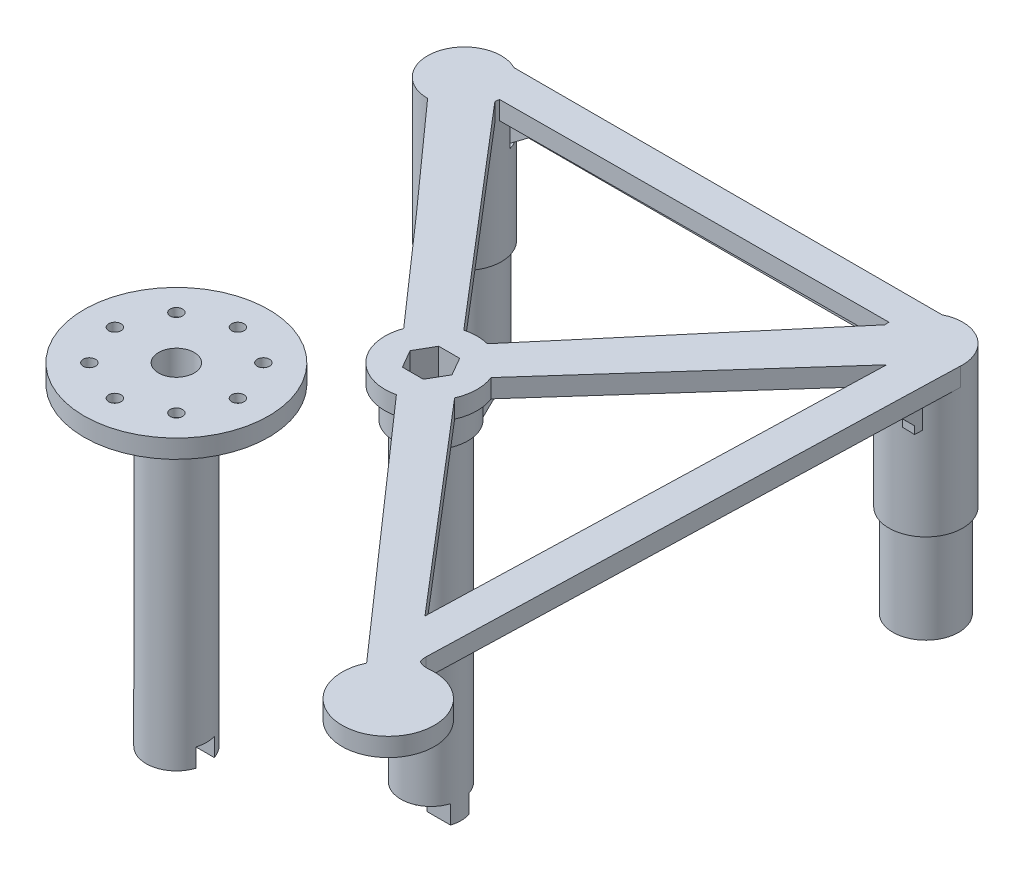
from build123d import *
from build123d.topology import SkipClean

# Parameters (mm, degrees)
EXTRUDE_1_DEPTH          = 3
SKETCH_2_R               = 5.35
EXTRUDE_2_DEPTH          = 23
CUT_EXTRUDE_1_DEPTH      = 3
SKETCH_4_R               = 5
EXTRUDE_3_DEPTH          = 100
EXTRUDE_START            = 3
SKETCH_5_R               = 5
EXTRUDE_4_DEPTH          = 3
SKETCH_6_R               = 5.35
EXTRUDE_5_DEPTH          = 5
SKETCH_7_R               = 5.35
EXTRUDE_6_DEPTH          = 5
SKETCH_8_W               = 75
SKETCH_8_H               = 10.7
EXTRUDE_7_DEPTH          = 3
EXTRUDE_8_DEPTH          = 3
CUT_EXTRUDE_2_DEPTH      = 3
SKETCH_12_R              = 6
EXTRUDE_10_DEPTH         = 13
SKETCH_13_R              = 3
CUT_EXTRUDE_3_DEPTH      = 23
SKETCH_14_R              = 3.125
CUT_EXTRUDE_5_DEPTH      = 100
SKETCH_15_R              = 6
SKETCH_15_R_2            = 5.35
EXTRUDE_11_DEPTH         = 5
SKETCH_16_R              = 6
SKETCH_16_R_2            = 3
EXTRUDE_12_DEPTH         = 5
SKETCH_17_R              = 5.35
SKETCH_17_R_2            = 3
EXTRUDE_13_DEPTH         = 5
SKETCH_18_R              = 5.35
SKETCH_18_R_2            = 3
EXTRUDE_14_DEPTH         = 5
SKETCH_20_R              = 6
SKETCH_20_R_2            = 5.35
EXTRUDE_15_DEPTH         = 5
SKETCH_21_R              = 6
SKETCH_21_R_2            = 5.35
EXTRUDE_16_DEPTH         = 5
SKETCH_22_R              = 5.35
SKETCH_22_R_2            = 3
EXTRUDE_17_DEPTH         = 5
SKETCH_23_R              = 5.35
SKETCH_23_R_2            = 3
EXTRUDE_18_DEPTH         = 5
SKETCH_25_R              = 7.5
EXTRUDE_20_DEPTH         = 3
EXTRUDE_21_DEPTH         = 3
EXTRUDE_23_DEPTH         = 3
SKETCH_30_R              = 7.5
EXTRUDE_24_DEPTH         = 3
FILLET_1_R               = 3
EXTRUDE_29_DEPTH         = 5
EXTRUDE_31_DEPTH         = 2
SKETCH_50_R              = 5.998205811
EXTRUDE_32_DEPTH         = 103
CUT_EXTRUDE_START        = -95
SKETCH_52_R              = 5.998205811
SKETCH_52_R_2            = 4.9
CUT_EXTRUDE_7_DEPTH      = 95
CUT_EXTRUDE_START_2      = -44
SKETCH_53_R              = 4.9
CUT_EXTRUDE_8_DEPTH      = 44
SKETCH_54_R              = 1.5
EXTRUDE_33_DEPTH         = 5
CUT_EXTRUDE_9_DEPTH      = 56
CUT_EXTRUDE_START_3      = -6
SKETCH_56_R              = 1.5
CUT_EXTRUDE_10_DEPTH     = 6
SKETCH_57_R              = 15
EXTRUDE_34_DEPTH         = 3
SKETCH_58_R              = 4.9
EXTRUDE_35_DEPTH         = 51
CUT_EXTRUDE_11_DEPTH     = 5
SKETCH_60_R              = 2.75
CUT_EXTRUDE_12_DEPTH     = 46
SKETCH_61_R              = 1.5
CUT_EXTRUDE_13_DEPTH     = 9
CUT_EXTRUDE_14_DEPTH     = 1.65
SKETCH_63_R              = 1
CUT_EXTRUDE_15_DEPTH     = 1.5
PATTERN_CIRCULAR_1_COUNT = 8
SKETCH_64_R              = 3.175426481
CUT_EXTRUDE_17_DEPTH     = 5
CUT_EXTRUDE_18_DEPTH     = 56
FILLET_2_R               = 1
EXTRUDE_36_DEPTH         = 5
SKETCH_67_R              = 1.5
CUT_EXTRUDE_19_DEPTH     = 5
FILLET_3_R               = 1
SKETCH_69_R              = 4.9
EXTRUDE_37_DEPTH         = 3
CUT_EXTRUDE_20_DEPTH     = 3
CUT_EXTRUDE_21_DEPTH     = 3
SKETCH_71_R              = 2.9
CUT_EXTRUDE_22_DEPTH     = 46
FILLET_4_R               = 1
SKETCH_72_R              = 1.742227019
CUT_EXTRUDE_23_DEPTH     = 3


with BuildPart() as part:
    # 草图1 → 凸台-拉伸1 (new body)
    with BuildSketch(Plane(origin=(0, 0, 0), x_dir=(1, 0, 0), z_dir=(0, 1, 0))):
        Polygon((-18.65535641, 0), (18.84464359, -42.930983399), (56.34464359, 0), align=None)
    extrude(amount=EXTRUDE_1_DEPTH)

    # 草图2 → 凸台-拉伸2 (add)
    with BuildSketch(Plane(origin=(0, 3, 0), x_dir=(1, 0, 0), z_dir=(0, 1, 0))):
        with Locations(Location((56.34464359, 0, 0), (0, 0, 270))):
            Circle(SKETCH_2_R)
        with Locations(Location((-18.65535641, 0, 0), (0, 0, 270))):
            Circle(SKETCH_2_R)
    extrude(amount=-EXTRUDE_2_DEPTH)

    # 草图3 → 切除-拉伸1 (cut)
    with BuildSketch(Plane.XZ):
        Polygon((8.632668758, 17.559374543), (1.15609776, 9), (33.75905687, 9), (36.53318942, 9), (29.056618422, 17.559374543), (18.84464359, 29.25031113), align=None)
    extrude(amount=-CUT_EXTRUDE_1_DEPTH, mode=Mode.SUBTRACT)

    # 草图4 → 凸台-拉伸3 (add)
    with BuildSketch(Plane.XZ):
        with Locations(Location((18.84464359, 42.930983399, 0), (0, 0, 228.862949093))):
            Circle(SKETCH_4_R)
    extrude(amount=EXTRUDE_3_DEPTH)

    # 草图5 → 凸台-拉伸4 (add)
    with BuildSketch(Plane(origin=(0, 0, 0), x_dir=(1, 0, 0), z_dir=(0, 1, 0)).offset(EXTRUDE_START)):
        with Locations(Location((18.84464359, -42.930983399, 0), (0, 0, 131.137050907))):
            Circle(SKETCH_5_R)
    extrude(amount=-EXTRUDE_4_DEPTH)

    # 草图6 → 凸台-拉伸5 (add)
    with SkipClean():  # the faces are left unmerged after this step: merging them gives an invalid solid
        with BuildSketch(Plane.XZ.offset(20)):
            with Locations(Location((56.34464359, 0, 0), (0, 0, 131.137050907))):
                Circle(SKETCH_6_R)
        extrude(amount=EXTRUDE_5_DEPTH)
    add(part.part.scale(1), mode=Mode.REPLACE)  # the faces are merged on a copy

    # 草图7 → 凸台-拉伸6 (add)
    with BuildSketch(Plane.XZ.offset(20)):
        with Locations(Location((-18.65535641, 0, 0), (0, 0, 48.862949093))):
            Circle(SKETCH_7_R)
    extrude(amount=EXTRUDE_6_DEPTH)

    # 草图8 → 凸台-拉伸7 (add)
    with SkipClean():  # the faces are left unmerged after this step: merging them gives an invalid solid
        with BuildSketch(Plane(origin=(0, 3, 0), x_dir=(1, 0, 0), z_dir=(0, 1, 0))):
            with Locations((18.84464359, 0)):
                Rectangle(SKETCH_8_W, SKETCH_8_H)
        extrude(amount=-EXTRUDE_7_DEPTH)

    # 草图9 → 凸台-拉伸8 (add)
    with SkipClean():  # the faces are left unmerged after this step: merging them gives an invalid solid
        with BuildSketch(Plane(origin=(0, 3, 0), x_dir=(1, 0, 0), z_dir=(0, 1, 0))):
            Polygon((61.69464359, 0), (18.84464359, -47.930983399), (-24.00535641, 0), align=None)
        extrude(amount=-EXTRUDE_8_DEPTH)

    # 草图10 → 切除-拉伸2 (cut)
    with SkipClean():  # the faces are left unmerged after this step: merging them gives an invalid solid
        with BuildSketch(Plane.XZ):
            Polygon((18.84464359, 37.930983399), (-13.313716495, 0.298969924), (50.99464359, 0), align=None)
        extrude(amount=-CUT_EXTRUDE_2_DEPTH, mode=Mode.SUBTRACT)

    # 草图12 → 凸台-拉伸10 (add)
    with SkipClean():  # the faces are left unmerged after this step: merging them gives an invalid solid
        with BuildSketch(Plane(origin=(0, 3, 0), x_dir=(1, 0, 0), z_dir=(0, 1, 0))):
            with Locations(Location((-18.65535641, 0, 0), (0, 0, 270))):
                Circle(SKETCH_12_R)
            with Locations(Location((56.34464359, 0, 0), (0, 0, 270))):
                Circle(SKETCH_12_R)
        extrude(amount=-EXTRUDE_10_DEPTH)

    # 草图13 → 切除-拉伸3 (cut)
    with SkipClean():  # the faces are left unmerged after this step: merging them gives an invalid solid
        with BuildSketch(Plane.XZ.offset(25)):
            with Locations(Location((-18.65535641, 0, 0), (0, 0, 270))):
                Circle(SKETCH_13_R)
            with Locations(Location((56.34464359, 0, 0), (0, 0, 270))):
                Circle(SKETCH_13_R)
        extrude(amount=-CUT_EXTRUDE_3_DEPTH, mode=Mode.SUBTRACT)

    # 草图14 → 切除-拉伸5 (cut)
    with SkipClean():  # the faces are left unmerged after this step: merging them gives an invalid solid
        with BuildSketch(Plane.XZ.offset(100)):
            with Locations(Location((18.84464359, 42.930983399, 0), (0, 0, 270))):
                Circle(SKETCH_14_R)
        extrude(amount=-CUT_EXTRUDE_5_DEPTH, mode=Mode.SUBTRACT)

    # 草图15 → 凸台-拉伸11 (add)
    with SkipClean():  # the faces are left unmerged after this step: merging them gives an invalid solid
        with BuildSketch(Plane.XZ.offset(10)):
            with Locations(Location((56.34464359, 0, 0), (0, 0, 90.133194259))):
                Circle(SKETCH_15_R)
            with Locations(Location((56.34464359, 0, 0), (0, 0, 270))):
                Circle(SKETCH_15_R_2, mode=Mode.SUBTRACT)
        extrude(amount=EXTRUDE_11_DEPTH)

    # 草图16 → 凸台-拉伸12 (add)
    with SkipClean():  # the faces are left unmerged after this step: merging them gives an invalid solid
        with BuildSketch(Plane.XZ.offset(10)):
            with Locations(Location((-18.65535641, 0, 0), (0, 0, 89.866805741))):
                Circle(SKETCH_16_R)
            with Locations(Location((-18.65535641, 0, 0), (0, 0, 270))):
                Circle(SKETCH_16_R_2, mode=Mode.SUBTRACT)
        extrude(amount=EXTRUDE_12_DEPTH)

    # 草图17 → 凸台-拉伸13 (add)
    with SkipClean():  # the faces are left unmerged after this step: merging them gives an invalid solid
        with BuildSketch(Plane.XZ.offset(25)):
            with Locations(Location((-18.65535641, 0, 0), (0, 0, 270))):
                Circle(SKETCH_17_R)
            with Locations(Location((-18.65535641, 0, 0), (0, 0, 270))):
                Circle(SKETCH_17_R_2, mode=Mode.SUBTRACT)
        extrude(amount=EXTRUDE_13_DEPTH)

    # 草图18 → 凸台-拉伸14 (add)
    with SkipClean():  # the faces are left unmerged after this step: merging them gives an invalid solid
        with BuildSketch(Plane.XZ.offset(25)):
            with Locations(Location((56.34464359, 0, 0), (0, 0, 270))):
                Circle(SKETCH_18_R)
            with Locations(Location((56.34464359, 0, 0), (0, 0, 270))):
                Circle(SKETCH_18_R_2, mode=Mode.SUBTRACT)
        extrude(amount=EXTRUDE_14_DEPTH)

    # 草图20 → 凸台-拉伸15 (add)
    with SkipClean():  # the faces are left unmerged after this step: merging them gives an invalid solid
        with BuildSketch(Plane.XZ.offset(15)):
            with Locations(Location((-18.65535641, 0, 0), (0, 0, 89.866805741))):
                Circle(SKETCH_20_R)
            with Locations(Location((-18.65535641, 0, 0), (0, 0, 270))):
                Circle(SKETCH_20_R_2, mode=Mode.SUBTRACT)
        extrude(amount=EXTRUDE_15_DEPTH)

    # 草图21 → 凸台-拉伸16 (add)
    with SkipClean():  # the faces are left unmerged after this step: merging them gives an invalid solid
        with BuildSketch(Plane.XZ.offset(15)):
            with Locations(Location((56.34464359, 0, 0), (0, 0, 90.133194259))):
                Circle(SKETCH_21_R)
            with Locations(Location((56.34464359, 0, 0), (0, 0, 270))):
                Circle(SKETCH_21_R_2, mode=Mode.SUBTRACT)
        extrude(amount=EXTRUDE_16_DEPTH)

    # 草图22 → 凸台-拉伸17 (add)
    with SkipClean():  # the faces are left unmerged after this step: merging them gives an invalid solid
        with BuildSketch(Plane.XZ.offset(30)):
            with Locations(Location((-18.65535641, 0, 0), (0, 0, 270))):
                Circle(SKETCH_22_R)
            with Locations(Location((-18.65535641, 0, 0), (0, 0, 270))):
                Circle(SKETCH_22_R_2, mode=Mode.SUBTRACT)
        extrude(amount=EXTRUDE_17_DEPTH)

    # 草图23 → 凸台-拉伸18 (add)
    with SkipClean():  # the faces are left unmerged after this step: merging them gives an invalid solid
        with BuildSketch(Plane.XZ.offset(30)):
            with Locations(Location((56.34464359, 0, 0), (0, 0, 270))):
                Circle(SKETCH_23_R)
            with Locations(Location((56.34464359, 0, 0), (0, 0, 270))):
                Circle(SKETCH_23_R_2, mode=Mode.SUBTRACT)
        extrude(amount=EXTRUDE_18_DEPTH)

    # 草图25 → 凸台-拉伸20 (add)
    with SkipClean():  # the faces are left unmerged after this step: merging them gives an invalid solid
        with BuildSketch(Plane(origin=(0, 3, 0), x_dir=(1, 0, 0), z_dir=(0, 1, 0))):
            with Locations((18.84464359, -42.930983399)):
                Circle(SKETCH_25_R)
        extrude(amount=-EXTRUDE_20_DEPTH)

    # 草图28 → 凸台-拉伸21 (add)
    with SkipClean():  # the faces are left unmerged after this step: merging them gives an invalid solid
        with BuildSketch(Plane(origin=(0, 3, 0), x_dir=(1, 0, 0), z_dir=(0, 1, 0))):
            Polygon((-3.379636645, -23.071435978), (2.093554995, -18.328702995), (68.652557408, -96.216669577), (66.868599364, -97.910067347), (64.321605904, -100.026810209), align=None)
        extrude(amount=-EXTRUDE_21_DEPTH)

    # 草图29 → 凸台-拉伸23 (add)
    with SkipClean():  # the faces are left unmerged after this step: merging them gives an invalid solid
        with BuildSketch(Plane(origin=(0, 3, 0), x_dir=(1, 0, 0), z_dir=(0, 1, 0))):
            Polygon((56.34464359, 0), (53.74105837, -88), (59.74105837, -88), (62.34464359, 0), align=None)
        extrude(amount=-EXTRUDE_23_DEPTH)

    # 草图30 → 凸台-拉伸24 (add)
    with SkipClean():  # the faces are left unmerged after this step: merging them gives an invalid solid
        with BuildSketch(Plane(origin=(0, 3, 0), x_dir=(1, 0, 0), z_dir=(0, 1, 0))):
            with Locations((62.6531538, -93.694621783)):
                Circle(SKETCH_30_R)
        extrude(amount=-EXTRUDE_24_DEPTH)

    # 圆角1
    # the kernel refuses this fillet: 3 mm, written as the material it adds along each edge
    with BuildSketch(Plane(origin=(60.387632696, 0, 86.544977448), x_dir=(-0.6496534253779116, 0, -0.760230509052844), z_dir=(0, 1, 0))) as fillet_1_piece_1:
        with BuildLine():
            CenterArc((1.763131122, -3), FILLET_1_R, 90, 55.663998218)
            ThreePointArc((-0.714100998, -1.307864951), (-0.324488751, -0.671711358), (0, 0))
            Line((0, 0), (1.763131122, 0))
        make_face()
    extrude(amount=3)
    with BuildSketch(Plane(origin=(59.804303017, 0, 85.862359607), x_dir=(0.02957325513951661, 0, -0.9995626156376863), z_dir=(0, 1, 0))) as fillet_1_piece_2:
        with BuildLine():
            CenterArc((FILLET_1_R * 0.38596961824, -FILLET_1_R), FILLET_1_R, 90, 42.210146514)
            Line((-FILLET_1_R * 0.285882149698, -FILLET_1_R * 0.259314370385), (0, 0))
            Line((0, 0), (FILLET_1_R * 0.38596961824, 0))
        make_face()
    extrude(amount=3)

    # 草图31 → 凸台-拉伸29 (add)
    with BuildSketch(Plane.XZ):
        Polygon((-14.723586471, -1.628179316), (-14.723586471, -3.628179316), (53.527409972, -3.628179316), (53.82491501, -1.628179316), align=None)
        Polygon((49.609847968, 80.102545011), (51.130308987, 78.80323816), (22.318773999, 45.087710689), (20.798312981, 46.38701754), align=None)
        Polygon((-15.349607435, 4.086383285), (-13.829146417, 2.787076434), (17.097273349, 38.977461836), (15.576812331, 40.276768687), align=None)
        Polygon((20.325894576, 39.186783249), (51.86894969, 1.971881231), (53.394639731, 3.265043982), (21.851584617, 40.479945999), align=None)
        Polygon((56.093860655, 78.864293565), (58.318881117, 3.659610745), (60.319756269, 3.659610745), (58.092985887, 78.923440075), align=None)
    extrude(amount=EXTRUDE_29_DEPTH)

    # 切除-扫描1: sweep along a path in 草图36
    with BuildLine(Plane.XZ.offset(5)) as sweep_1_path:
        Line((18.84464359, -3.628179316), (18.84464359, -1.628179316))
    # 草图35 → 切除-扫描1 (sweep, cut)
    with BuildSketch(Plane(origin=(0, 0, -3.628179316), x_dir=(-1, 0, 0), z_dir=(0, 0, -1))):
        Polygon((13.876620714, -5), (9.876620714, -2), (-47.565907894, -2), (-51.565907894, -5), align=None)
    sweep(path=sweep_1_path.line, mode=Mode.SUBTRACT)

    # 切除-扫描3: sweep along a path in 草图38
    with BuildLine(Plane.XZ.offset(5)) as sweep_3_path:
        Line((59.19369399, 41.720005215), (57.192818839, 41.720005215))
    # 草图37 → 切除-扫描3 (sweep, cut)
    with BuildSketch(Plane(origin=(60.375181238, 0, 1.786271926), x_dir=(0.029573255139513054, 0, -0.9995626156376864), z_dir=(0.9995626156376866, 0, 0.029573255139513057))):
        Polygon((-2.73149314, -5), (-6.73149314, -1), (-73.170921503, -1), (-77.170921503, -5), align=None)
    sweep(path=sweep_3_path.line, mode=Mode.SUBTRACT)

    # 草图39 → 凸台-拉伸31 (add)
    with BuildSketch(Plane(origin=(58.376056006, 0, 1.727125416), x_dir=(0.02957325513951297, 0, -0.9995626156376864), z_dir=(0.9995626156376866, 0, 0.029573255139512974))):
        Polygon((-3.961044, -3.829621531), (-3.961044, -5), (-2.73149314, -5), (-2.73149314, -4.501704435), (-3.961044, -3.272153575), align=None)
    extrude(amount=EXTRUDE_31_DEPTH)

    # 切除-扫描5: sweep along a path in 草图42
    with BuildLine(Plane.XZ.offset(5)) as sweep_5_path:
        Line((0.095091388, 22.159914171), (1.552120507, 20.786378718))
    # 草图40 → 切除-扫描5 (sweep, cut)
    with BuildSketch(Plane(origin=(-10.889521113, 0, 9.305617977), x_dir=(0.6496534253779145, 0, 0.7602305090528415), z_dir=(-0.7602305090528415, 0, 0.6496534253779145))):
        Polygon((-5.121187346, -5), (-3.121187346, -1), (36.9380259, -1), (38.9380259, -5), align=None)
    sweep(path=sweep_5_path.line, mode=Mode.SUBTRACT)

    # 切除-扫描6: sweep along a path in 草图44
    with BuildLine(Plane.XZ.offset(5)) as sweep_6_path:
        Line((36.035656698, 20.652203895), (37.472857905, 22.049766909))
    # 草图43 → 切除-扫描6 (sweep, cut)
    with BuildSketch(Plane(origin=(31.1568423, 0, 26.408291855), x_dir=(-0.6465813751887421, 0, 0.7628450204720715), z_dir=(-0.7628450204720715, 0, -0.6465813751887421))):
        Polygon((14.734624595, -5), (12.734624595, -1), (-27.825731715, -1), (-29.825731715, -5), align=None)
    sweep(path=sweep_6_path.line, mode=Mode.SUBTRACT)

    # 切除-扫描7: sweep along a path in 草图47
    with BuildLine(Plane.XZ.offset(5)) as sweep_7_path:
        Line((37.03221924, 62.305521799), (35.511758222, 63.60482865))
    # 草图46 → 切除-扫描7 (sweep, cut)
    with BuildSketch(Plane(origin=(-10.889521113, 0, 9.305617977), x_dir=(0.6496534253779142, 0, 0.7602305090528417), z_dir=(-0.7602305090528417, 0, 0.6496534253779142))):
        Polygon((50.821835343, -5), (52.821835343, -1), (88.125606235, -1), (93.125606235, 0), (93.125606235, -5), align=None)
    sweep(path=sweep_7_path.line, mode=Mode.SUBTRACT)

    # 切除-扫描8: sweep along a path in 草图49
    with BuildLine(Plane.XZ.offset(1)) as sweep_8_path:
        Line((58.211278907, 74.925189613), (56.210403756, 74.925189613))
        Line((56.210403756, 74.925189613), (55.379994456, 74.925189613))
    # 草图48 → 切除-扫描8 (sweep, cut)
    with BuildSketch(Plane(origin=(60.375181238, 0, 1.786271926), x_dir=(0.029573255139513054, 0, -0.9995626156376864), z_dir=(0.9995626156376866, 0, 0.029573255139513057))):
        Polygon((-73.170921503, -1), (-77.170921503, 0), (-77.170921503, -5), align=None)
    sweep(path=sweep_8_path.line, mode=Mode.SUBTRACT)

    # 草图50 → 凸台-拉伸32 (add)
    with BuildSketch(Plane(origin=(0, 3, 0), x_dir=(1, 0, 0), z_dir=(0, 1, 0))):
        with Locations(Location((18.84464359, -42.930983399, 0), (0, 0, 270))):
            Circle(SKETCH_50_R)
    extrude(amount=-EXTRUDE_32_DEPTH)

    # 草图52 → 切除-拉伸7 (cut)
    with BuildSketch(Plane.XZ.offset(100).offset(CUT_EXTRUDE_START)):
        with Locations((18.84464359, 42.930983399)):
            Circle(SKETCH_52_R)
        with Locations(Location((18.84464359, 42.930983399, 0), (0, 0, 270))):
            Circle(SKETCH_52_R_2, mode=Mode.SUBTRACT)
    extrude(amount=CUT_EXTRUDE_7_DEPTH, mode=Mode.SUBTRACT)

    # 草图53 → 切除-拉伸8 (cut)
    with BuildSketch(Plane.XZ.offset(100).offset(CUT_EXTRUDE_START_2)):
        with Locations(Location((18.84464359, 42.930983399, 0), (0, 0, 270))):
            Circle(SKETCH_53_R)
    extrude(amount=CUT_EXTRUDE_8_DEPTH, mode=Mode.SUBTRACT)

    # 草图54 → 凸台-拉伸33 (add)
    with BuildSketch(Plane.XZ.offset(56)):
        Polygon((22.020070071, 42.930983399), (20.43235683, 45.680983399), (17.25693035, 45.680983399), (15.669217109, 42.930983399), (17.25693035, 40.180983399), (20.43235683, 40.180983399), align=None)
        with Locations(Location((18.84464359, 42.930983399, 0), (0, 0, 270))):
            Circle(SKETCH_54_R, mode=Mode.SUBTRACT)
    extrude(amount=EXTRUDE_33_DEPTH)

    # 草图55 → 切除-拉伸9 (cut)
    with BuildSketch(Plane(origin=(0, 3, 0), x_dir=(1, 0, 0), z_dir=(0, 1, 0))):
        Polygon((22.077805097, -42.930983399), (20.461224344, -40.130983399), (17.228062836, -40.130983399), (15.611482083, -42.930983399), (17.228062836, -45.730983399), (20.461224344, -45.730983399), align=None)
    extrude(amount=-CUT_EXTRUDE_9_DEPTH, mode=Mode.SUBTRACT)

    # 草图56 → 切除-拉伸10 (cut)
    with BuildSketch(Plane.XZ.offset(56).offset(CUT_EXTRUDE_START_3)):
        with Locations(Location((18.84464359, 42.930983399, 0), (0, 0, 90))):
            Circle(SKETCH_56_R)
    extrude(amount=CUT_EXTRUDE_10_DEPTH, mode=Mode.SUBTRACT)

    # 草图64 → 切除-拉伸17 (cut)
    with BuildSketch(Plane.XZ.offset(61)):
        with Locations((18.84464359, 42.930983399)):
            Circle(SKETCH_64_R)
    extrude(amount=-CUT_EXTRUDE_17_DEPTH, mode=Mode.SUBTRACT)

    # 草图65 → 切除-拉伸18 (cut)
    with BuildSketch(Plane(origin=(0, 3, 0), x_dir=(1, 0, 0), z_dir=(0, 1, 0))):
        Polygon((22.251010178, -42.930983399), (20.547826884, -39.980983399), (17.141460296, -39.980983399), (15.438277002, -42.930983399), (17.141460296, -45.880983399), (20.547826884, -45.880983399), align=None)
    extrude(amount=-CUT_EXTRUDE_18_DEPTH, mode=Mode.SUBTRACT)

    # 圆角2
    # the kernel refuses this fillet: 1 mm, written as the material it adds along each edge
    with BuildSketch(Plane(origin=(19.297826884, -53, 48.046046908), x_dir=(0, 1, 0), z_dir=(0.49999999999999994, 0, -0.8660254037844387))) as fillet_2_piece_1_section:
        with BuildLine():
            CenterArc((FILLET_2_R, -FILLET_2_R), FILLET_2_R, 90, 90)
            Line((0, -FILLET_2_R), (0, 0))
            Line((0, 0), (FILLET_2_R, 0))
        make_face()
    fillet_2_piece_1 = extrude(amount=8.406366588, mode=Mode.PRIVATE)
    fillet_2_piece_1 = split(fillet_2_piece_1, bisect_by=Plane(origin=(21.196381273, -52.783149841, 45.880983399), z_dir=(0, 0, -1)), keep=Keep.TOP, mode=Mode.PRIVATE)
    fillet_2_piece_1 = split(fillet_2_piece_1, bisect_by=Plane(origin=(22.575287373, -52.783149841, 43.492647975), z_dir=(-0.8660254037844382, 0, 0.5000000000000009)), keep=Keep.TOP, mode=Mode.PRIVATE)
    add(fillet_2_piece_1)
    with BuildSketch(Plane(origin=(14.641460296, -53, 45.880983399), x_dir=(0, 1, 0), z_dir=(1, 0, 0))) as fillet_2_piece_2_section:
        with BuildLine():
            CenterArc((FILLET_2_R, -FILLET_2_R), FILLET_2_R, 90, 90)
            Line((0, -FILLET_2_R), (0, 0))
            Line((0, 0), (FILLET_2_R, 0))
        make_face()
    fillet_2_piece_2 = extrude(amount=8.406366588, mode=Mode.PRIVATE)
    fillet_2_piece_2 = split(fillet_2_piece_2, bisect_by=Plane(origin=(20.22354969, -52.783149841, 46.442647975), z_dir=(-0.8660254037844387, 0, -0.49999999999999994)), keep=Keep.TOP, mode=Mode.PRIVATE)
    fillet_2_piece_2 = split(fillet_2_piece_2, bisect_by=Plane(origin=(17.46573749, -52.783149841, 46.442647975), z_dir=(0.8660254037844393, 0, -0.49999999999999906)), keep=Keep.TOP, mode=Mode.PRIVATE)
    add(fillet_2_piece_2)
    with BuildSketch(Plane(origin=(14.188277002, -53, 40.765919889), x_dir=(0, 1, 0), z_dir=(0.49999999999999906, 0, 0.8660254037844393))) as fillet_2_piece_3_section:
        with BuildLine():
            CenterArc((FILLET_2_R, -FILLET_2_R), FILLET_2_R, 90, 90)
            Line((0, -FILLET_2_R), (0, 0))
            Line((0, 0), (FILLET_2_R, 0))
        make_face()
    fillet_2_piece_3 = extrude(amount=8.406366588, mode=Mode.PRIVATE)
    fillet_2_piece_3 = split(fillet_2_piece_3, bisect_by=Plane(origin=(16.492905907, -52.783149841, 45.880983399), z_dir=(0, 0, -1)), keep=Keep.TOP, mode=Mode.PRIVATE)
    fillet_2_piece_3 = split(fillet_2_piece_3, bisect_by=Plane(origin=(15.113999807, -52.783149841, 43.492647975), z_dir=(0.8660254037844386, 0, 0.5000000000000002)), keep=Keep.TOP, mode=Mode.PRIVATE)
    add(fillet_2_piece_3)
    with BuildSketch(Plane(origin=(18.391460296, -53, 37.815919889), x_dir=(0, 1, 0), z_dir=(-0.5000000000000002, 0, 0.8660254037844386))) as fillet_2_piece_4_section:
        with BuildLine():
            CenterArc((FILLET_2_R, -FILLET_2_R), FILLET_2_R, 90, 90)
            Line((0, -FILLET_2_R), (0, 0))
            Line((0, 0), (FILLET_2_R, 0))
        make_face()
    fillet_2_piece_4 = extrude(amount=8.406366588, mode=Mode.PRIVATE)
    fillet_2_piece_4 = split(fillet_2_piece_4, bisect_by=Plane(origin=(15.113999807, -52.783149841, 42.369318822), z_dir=(0.8660254037844393, 0, -0.49999999999999906)), keep=Keep.TOP, mode=Mode.PRIVATE)
    fillet_2_piece_4 = split(fillet_2_piece_4, bisect_by=Plane(origin=(16.492905907, -52.783149841, 39.980983399), z_dir=(0, 0, 1)), keep=Keep.TOP, mode=Mode.PRIVATE)
    add(fillet_2_piece_4)
    with BuildSketch(Plane(origin=(23.047826884, -53, 39.980983399), x_dir=(0, 1, 0), z_dir=(-1, 0, 0))) as fillet_2_piece_5_section:
        with BuildLine():
            CenterArc((FILLET_2_R, -FILLET_2_R), FILLET_2_R, 90, 90)
            Line((0, -FILLET_2_R), (0, 0))
            Line((0, 0), (FILLET_2_R, 0))
        make_face()
    fillet_2_piece_5 = extrude(amount=8.406366588, mode=Mode.PRIVATE)
    fillet_2_piece_5 = split(fillet_2_piece_5, bisect_by=Plane(origin=(17.46573749, -52.783149841, 39.419318822), z_dir=(0.8660254037844386, 0, 0.5000000000000002)), keep=Keep.TOP, mode=Mode.PRIVATE)
    fillet_2_piece_5 = split(fillet_2_piece_5, bisect_by=Plane(origin=(20.22354969, -52.783149841, 39.419318822), z_dir=(-0.8660254037844382, 0, 0.5000000000000009)), keep=Keep.TOP, mode=Mode.PRIVATE)
    add(fillet_2_piece_5)
    with BuildSketch(Plane(origin=(23.501010178, -53, 45.096046908), x_dir=(0, 1, 0), z_dir=(-0.5000000000000009, 0, -0.8660254037844382))) as fillet_2_piece_6_section:
        with BuildLine():
            CenterArc((FILLET_2_R, -FILLET_2_R), FILLET_2_R, 90, 90)
            Line((0, -FILLET_2_R), (0, 0))
            Line((0, 0), (FILLET_2_R, 0))
        make_face()
    fillet_2_piece_6 = extrude(amount=8.406366588, mode=Mode.PRIVATE)
    fillet_2_piece_6 = split(fillet_2_piece_6, bisect_by=Plane(origin=(22.575287373, -52.783149841, 42.369318822), z_dir=(-0.8660254037844387, 0, -0.49999999999999994)), keep=Keep.TOP, mode=Mode.PRIVATE)
    fillet_2_piece_6 = split(fillet_2_piece_6, bisect_by=Plane(origin=(21.196381273, -52.783149841, 39.980983399), z_dir=(0, 0, 1)), keep=Keep.TOP, mode=Mode.PRIVATE)
    add(fillet_2_piece_6)

    # 草图69 → 凸台-拉伸37 (add)
    with BuildSketch(Plane.XZ.offset(56)):
        with Locations(Location((18.84464359, 42.930983399, 0), (0, 0, 270))):
            Circle(SKETCH_69_R)
    extrude(amount=EXTRUDE_37_DEPTH)

    # 草图68 → 切除-拉伸20 (cut)
    with BuildSketch(Plane.XZ.offset(56)):
        Polygon((17.97353008, 41.422170541), (13.94464359, 41.430983399), (15.863729909, 37.533957775), (21.64727463, 37.627802071), (23.74464359, 41.430983399), (19.7157571, 41.422170541), (20.586870609, 42.930983399), (19.7157571, 44.439796256), (23.74464359, 44.430983399), (21.991739507, 48.037279535), (15.697547673, 48.037279535), (13.94464359, 44.430983399), (17.97353008, 44.439796256), (17.102416571, 42.930983399), align=None)
    extrude(amount=CUT_EXTRUDE_20_DEPTH, mode=Mode.SUBTRACT)

    # 草图72 → 切除-拉伸23 (cut)
    with BuildSketch(Plane.XZ.offset(56)):
        with Locations((18.84464359, 42.930983399)):
            Circle(SKETCH_72_R)
    extrude(amount=CUT_EXTRUDE_23_DEPTH, mode=Mode.SUBTRACT)


with BuildPart() as body_2:
    # 草图57 → 凸台-拉伸34 (new body)
    with BuildSketch(Plane(origin=(0, 0, 0), x_dir=(1, 0, 0), z_dir=(0, 1, 0))):
        with Locations(Location((-1.85085497, -63.626481958, 0), (0, 0, 270))):
            Circle(SKETCH_57_R)
    extrude(amount=EXTRUDE_34_DEPTH)

    # 草图58 → 凸台-拉伸35 (add)
    with BuildSketch(Plane.XZ):
        with Locations(Location((-1.85085497, 63.626481958, 0), (0, 0, 90))):
            Circle(SKETCH_58_R)
    extrude(amount=EXTRUDE_35_DEPTH)

    # 草图59 → 切除-拉伸11 (cut)
    with BuildSketch(Plane.XZ.offset(51)):
        Polygon((1.324571511, 63.626481958), (-0.263141729, 66.376481958), (-3.43856821, 66.376481958), (-5.02628145, 63.626481958), (-3.43856821, 60.876481958), (-0.263141729, 60.876481958), align=None)
    extrude(amount=-CUT_EXTRUDE_11_DEPTH, mode=Mode.SUBTRACT)

    # 草图60 → 切除-拉伸12 (cut)
    with BuildSketch(Plane(origin=(0, 3, 0), x_dir=(1, 0, 0), z_dir=(0, 1, 0))):
        with Locations(Location((-1.85085497, -63.626481958, 0), (0, 0, 270))):
            Circle(SKETCH_60_R)
    extrude(amount=-CUT_EXTRUDE_12_DEPTH, mode=Mode.SUBTRACT)

    # 草图61 → 切除-拉伸13 (cut)
    with BuildSketch(Plane.XZ.offset(46)):
        with Locations(Location((-1.85085497, 63.626481958, 0), (0, 0, 270))):
            Circle(SKETCH_61_R)
    extrude(amount=-CUT_EXTRUDE_13_DEPTH, mode=Mode.SUBTRACT)

    # 草图62 → 切除-拉伸14 (cut)
    with BuildSketch(Plane.XZ):
        Polygon((10.516281134, 63.626481958), (9.332713082, 65.676481958), (6.965576978, 65.676481958), (5.782008927, 63.626481958), (6.965576978, 61.576481958), (9.332713082, 61.576481958), align=None)
    cut_extrude_14 = extrude(amount=-CUT_EXTRUDE_14_DEPTH, mode=Mode.SUBTRACT)

    # 草图63 → 切除-拉伸15 (cut)
    with BuildSketch(Plane.XZ.offset(-1.65)):
        with Locations(Location((8.14914503, 63.626481958, 0), (0, 0, 270))):
            Circle(SKETCH_63_R)
    cut_extrude_15 = extrude(amount=-CUT_EXTRUDE_15_DEPTH, mode=Mode.SUBTRACT)

    # 阵列(圆周)1: 切除-拉伸14, 切除-拉伸15 ×8 about axis
    pattern_circular_1_axis = Axis((-1.85085497, 0, 63.626481958), (0, 1, 0))
    add([cut_extrude_14.rotate(pattern_circular_1_axis, i * 360 / PATTERN_CIRCULAR_1_COUNT) for i in range(1, PATTERN_CIRCULAR_1_COUNT)], mode=Mode.SUBTRACT)
    add([cut_extrude_15.rotate(pattern_circular_1_axis, i * 360 / PATTERN_CIRCULAR_1_COUNT) for i in range(1, PATTERN_CIRCULAR_1_COUNT)], mode=Mode.SUBTRACT)

    # 草图66 → 凸台-拉伸36 (add)
    with BuildSketch(Plane.XZ.offset(51)):
        Polygon((1.324571511, 63.626481958), (-0.263141729, 66.376481958), (-3.43856821, 66.376481958), (-5.02628145, 63.626481958), (-3.43856821, 60.876481958), (-0.263141729, 60.876481958), align=None)
    extrude(amount=-EXTRUDE_36_DEPTH)

    # 草图67 → 切除-拉伸19 (cut)
    with BuildSketch(Plane.XZ.offset(51)):
        with Locations(Location((-1.85085497, 63.626481958, 0), (0, 0, 270))):
            Circle(SKETCH_67_R)
    extrude(amount=-CUT_EXTRUDE_19_DEPTH, mode=Mode.SUBTRACT)

    # 圆角3
    fillet_3_edges = [body_2.edges().sort_by_distance(p)[0] for p in [
        (-1.85085497, -43, 60.876481958),
    ]]
    fillet(fillet_3_edges, radius=FILLET_3_R)

    # 草图70 → 切除-拉伸21 (cut)
    with BuildSketch(Plane.XZ.offset(51)):
        Polygon((-2.716880374, 65.126481958), (-0.984829566, 65.126481958), (3.220078331, 65.126481958), (3.220078331, 62.126481958), (-0.984829566, 62.126481958), (-2.716880374, 62.126481958), (-7.47972899, 62.126481958), (-7.47972899, 65.126481958), align=None)
    extrude(amount=-CUT_EXTRUDE_21_DEPTH, mode=Mode.SUBTRACT)

    # 草图71 → 切除-拉伸22 (cut)
    with BuildSketch(Plane(origin=(0, 3, 0), x_dir=(1, 0, 0), z_dir=(0, 1, 0))):
        with Locations(Location((-1.85085497, -63.626481958, 0), (0, 0, 270))):
            Circle(SKETCH_71_R)
    extrude(amount=-CUT_EXTRUDE_22_DEPTH, mode=Mode.SUBTRACT)

    # 圆角4
    fillet_4_edges = [body_2.edges().sort_by_distance(p)[0] for p in [
        (-1.85085497, -43, 60.726481958),
    ]]
    fillet(fillet_4_edges, radius=FILLET_4_R)


solid = Compound([part.part, body_2.part])
